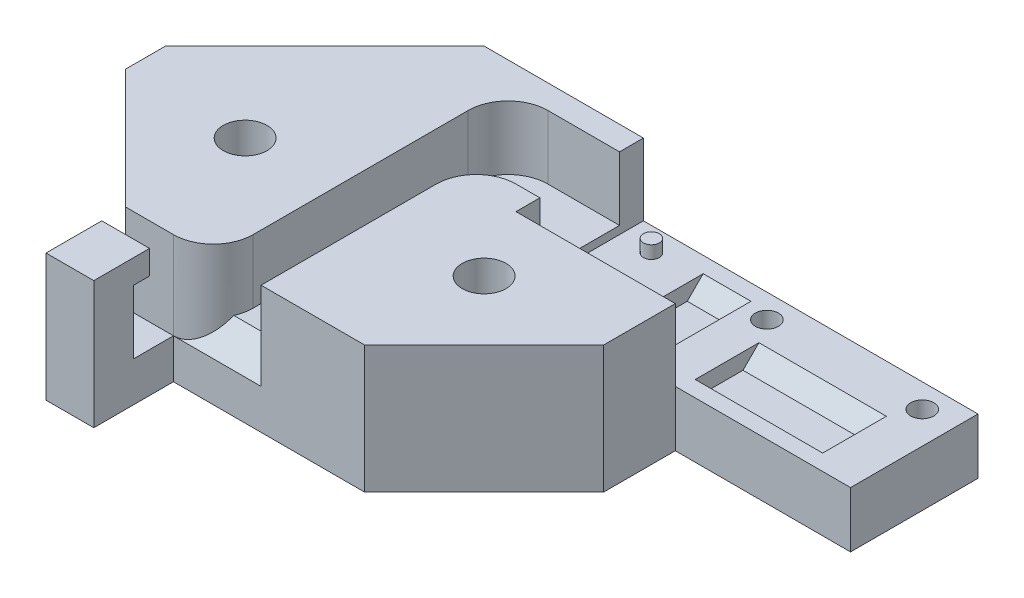
from build123d import *

# Parameters (mm, degrees)
SKETCH1_W           = 42
SKETCH1_H           = 16
BOSS_EXTRUDE1_DEPTH = 7
SKETCH2_R           = 1
BOSS_EXTRUDE2_DEPTH = 1.6
CUT_EXTRUDE1_REACH  = 26.062
SKETCH3_R           = 1.45
BOSS_EXTRUDE3_DEPTH = 16
CUT_EXTRUDE2_REACH  = 72.718
SKETCH5_R           = 2.75
BOSS_EXTRUDE4_DEPTH = 6
CUT_EXTRUDE3_DEPTH  = 8
FILLET1_R           = 5
CHAMFER2_SIZE       = 3
CHAMFER3_SIZE       = 15
CHAMFER5_SIZE       = 20
SKETCH8_W           = 16
SKETCH8_H           = 4
SKETCH8_W_2         = 6
SKETCH8_H_2         = 10
CUT_EXTRUDE4_DEPTH  = 2
CHAMFER6_SIZE       = 2


with BuildPart() as part:
    # Sketch1 → Boss-Extrude1 (new body)
    with BuildSketch(Plane(origin=(0, 0, 0), x_dir=(1, 0, 0), z_dir=(0, 1, 0))):
        Rectangle(SKETCH1_W, SKETCH1_H)
    extrude(amount=BOSS_EXTRUDE1_DEPTH)

    # Sketch2 → Boss-Extrude2 (add)
    with BuildSketch(Plane(origin=(0, 7, 0), x_dir=(1, 0, 0), z_dir=(0, 1, 0))):
        with Locations(Location((-17, 5, 0), (0, 0, 270))):
            Circle(SKETCH2_R)
        with Locations(Location((-17, -5, 0), (0, 0, 270))):
            Circle(SKETCH2_R)
    extrude(amount=BOSS_EXTRUDE2_DEPTH)

    # Sketch3 → Cut-Extrude1 (cut, up to next)
    with BuildSketch(Plane(origin=(0, 0, 0), x_dir=(1, 0, 0), z_dir=(0, 1, 0)), mode=Mode.PRIVATE) as cut_extrude1_sk1:
        with Locations(Location((-2.5, 5, 0), (0, 0, 270))):
            Circle(SKETCH3_R)
    cut_extrude1_tool1 = extrude(cut_extrude1_sk1.sketch, amount=CUT_EXTRUDE1_REACH, mode=Mode.PRIVATE) & part.part
    # Sketch3 → Cut-Extrude1 (cut, up to next)
    with BuildSketch(Plane(origin=(0, 0, 0), x_dir=(1, 0, 0), z_dir=(0, 1, 0)), mode=Mode.PRIVATE) as cut_extrude1_sk2:
        with Locations(Location((17, 5, 0), (0, 0, 270))):
            Circle(SKETCH3_R)
    cut_extrude1_tool2 = extrude(cut_extrude1_sk2.sketch, amount=CUT_EXTRUDE1_REACH, mode=Mode.PRIVATE) & part.part
    add(cut_extrude1_tool1.solids().sort_by_distance((-2.5, 0, -5))[0], mode=Mode.SUBTRACT)
    add(cut_extrude1_tool2.solids().sort_by_distance((17, 0, -5))[0], mode=Mode.SUBTRACT)

    # Sketch4 → Boss-Extrude3 (add)
    with BuildSketch(Plane(origin=(0, 0, 0), x_dir=(1, 0, 0), z_dir=(0, 1, 0))):
        Polygon((-1, -8), (-21, -8), (-21, 8), (-61, 8), (-61, -32), (-1, -32), align=None)
    extrude(amount=BOSS_EXTRUDE3_DEPTH)

    # Sketch5 → Cut-Extrude2 (cut, up to next)
    with BuildSketch(Plane(origin=(0, 0, 0), x_dir=(1, 0, 0), z_dir=(0, 1, 0)), mode=Mode.PRIVATE) as cut_extrude2_sk1:
        with Locations(Location((-46, -17, 0), (0, 0, 270))):
            Circle(SKETCH5_R)
    cut_extrude2_tool1 = extrude(cut_extrude2_sk1.sketch, amount=CUT_EXTRUDE2_REACH, mode=Mode.PRIVATE) & part.part
    # Sketch5 → Cut-Extrude2 (cut, up to next)
    with BuildSketch(Plane(origin=(0, 0, 0), x_dir=(1, 0, 0), z_dir=(0, 1, 0)), mode=Mode.PRIVATE) as cut_extrude2_sk2:
        with Locations(Location((-16, -17, 0), (0, 0, 270))):
            Circle(SKETCH5_R)
    cut_extrude2_tool2 = extrude(cut_extrude2_sk2.sketch, amount=CUT_EXTRUDE2_REACH, mode=Mode.PRIVATE) & part.part
    add(cut_extrude2_tool1.solids().sort_by_distance((-46, 0, 17))[0], mode=Mode.SUBTRACT)
    add(cut_extrude2_tool2.solids().sort_by_distance((-16, 0, 17))[0], mode=Mode.SUBTRACT)

    # Sketch6 → Boss-Extrude4 (add)
    with BuildSketch(Plane(origin=(-40, 0, 0), x_dir=(0, 0, -1), z_dir=(1, 0, 0))):
        Polygon((-32, 0), (-42, 0), (-42, 16), (-35, 16), (-35, 13), (-37, 13), (-37, 5), (-32, 5), align=None)
    extrude(amount=-BOSS_EXTRUDE4_DEPTH)

    # Sketch7 → Cut-Extrude3 (cut)
    with BuildSketch(Plane(origin=(0, 16, 0), x_dir=(1, 0, 0), z_dir=(0, 1, 0))):
        Polygon((-21, 5), (-21, -5), (-29, -5), (-29, -32), (-35, -32), (-35, 5), align=None)
    extrude(amount=-CUT_EXTRUDE3_DEPTH, mode=Mode.SUBTRACT)

    # Fillet1
    fillet1_edges = [part.edges().sort_by_distance(p)[0] for p in [
        (-35, 12, -5),
        (-29, 12, 5),
        (-35, 12, 32),
    ]]
    fillet(fillet1_edges, radius=FILLET1_R)

    # Chamfer2
    chamfer2_edges = [part.edges().sort_by_distance(p)[0] for p in [
        (-34.5, 8, 32),
    ]]
    chamfer(chamfer2_edges, length=CHAMFER2_SIZE)

    # Chamfer3
    chamfer3_edges = [part.edges().sort_by_distance(p)[0] for p in [
        (-1, 8, 32),
        (-61, 8, 32),
    ]]
    chamfer(chamfer3_edges, length=CHAMFER3_SIZE)

    # Chamfer5
    chamfer5_edges = [part.edges().sort_by_distance(p)[0] for p in [
        (-61, 8, -8),
    ]]
    chamfer(chamfer5_edges, length=CHAMFER5_SIZE)

    # Sketch8 → Cut-Extrude4 (cut)
    with BuildSketch(Plane(origin=(0, 7, 0), x_dir=(1, 0, 0), z_dir=(0, 1, 0))):
        with Locations((7.5, -2)):
            Rectangle(SKETCH8_W, SKETCH8_H)
        with Locations((-8.5, 1)):
            Rectangle(SKETCH8_W_2, SKETCH8_H_2)
    extrude(amount=-CUT_EXTRUDE4_DEPTH, mode=Mode.SUBTRACT)

    # Chamfer6
    chamfer6_edges = [part.edges().sort_by_distance(p)[0] for p in [
        (7.5, 7, 4),
        (7.5, 7, 0),
        (-8.5, 7, 4),
        (-8.5, 5, -6),
    ]]
    chamfer(chamfer6_edges, length=CHAMFER6_SIZE - 0.0001)  # a hair under: the kernel refuses the full size


solid = part.part
